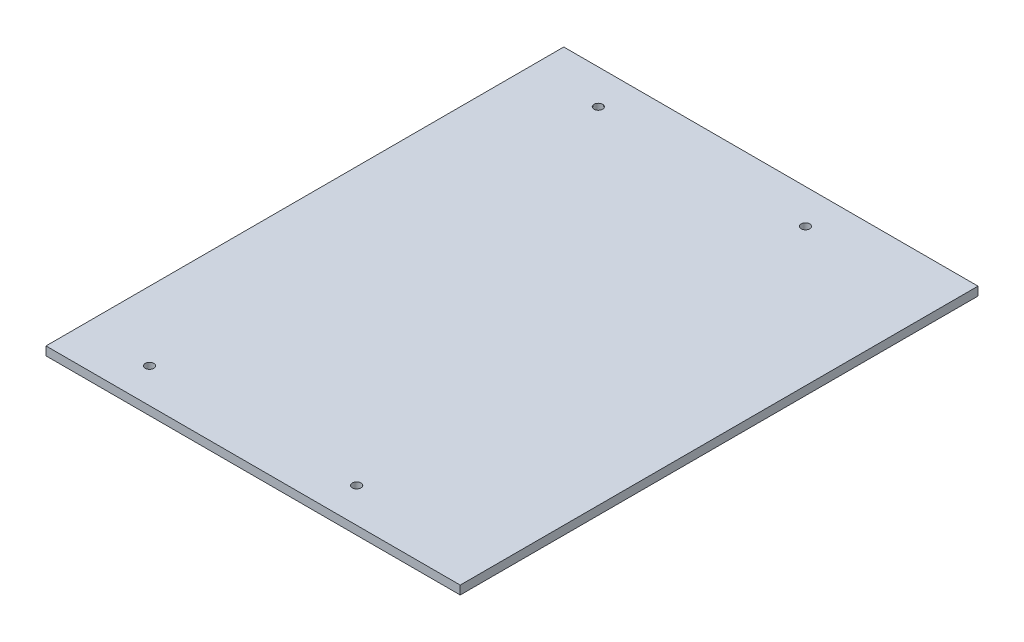
from build123d import *

# Parameters (mm, degrees)
SKETCH_1_W      = 152.4
SKETCH_1_H      = 190.5
SKETCH_1_R      = 1.5875
EXTRUDE_1_DEPTH = 3.175


with BuildPart() as part:
    # 스케치1 → 보스-돌출1 (new body)
    with BuildSketch(Plane(origin=(0, 0, 0), x_dir=(1, 0, 0), z_dir=(0, 1, 0))):
        with Locations((-25.4, 0)):
            Rectangle(SKETCH_1_W, SKETCH_1_H)
        with Locations((0, -82.55)):
            Circle(SKETCH_1_R, mode=Mode.SUBTRACT)
        with Locations((-76.2, -82.55)):
            Circle(SKETCH_1_R, mode=Mode.SUBTRACT)
        with Locations((-76.2, 82.55)):
            Circle(SKETCH_1_R, mode=Mode.SUBTRACT)
        with Locations((0, 82.55)):
            Circle(SKETCH_1_R, mode=Mode.SUBTRACT)
    extrude(amount=EXTRUDE_1_DEPTH)


solid = part.part
